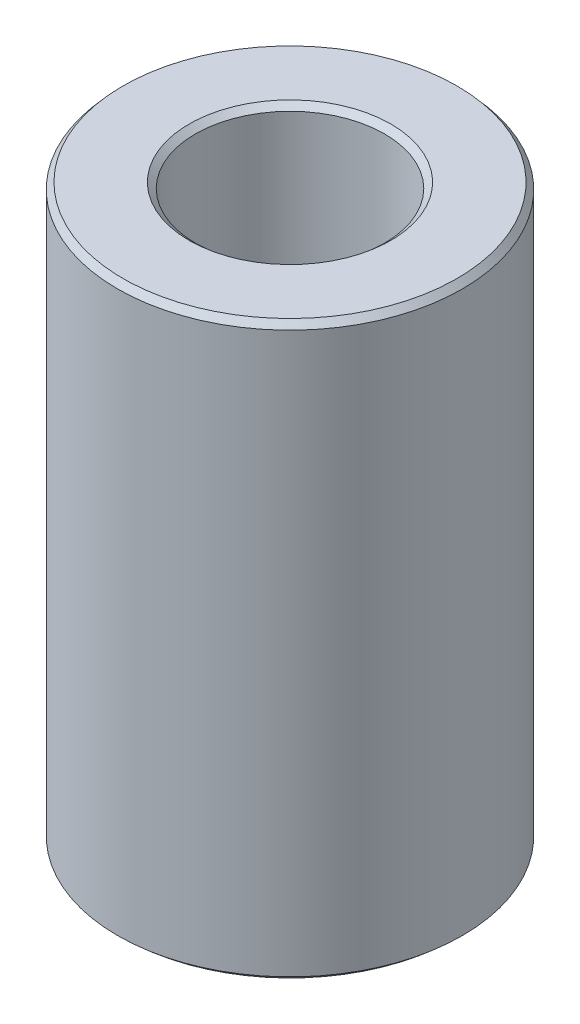
from build123d import *
from OCP.BRepFilletAPI import BRepFilletAPI_MakeChamfer

# Parameters (mm, degrees)
SKETCH1_R           = 12.5
BOSS_EXTRUDE1_DEPTH = 41.463838457
SKETCH2_R           = 6.860220899
CUT_EXTRUDE1_DEPTH  = 46.07493649
CHAMFER1_SIZE       = 0.454538693
CHAMFER1_SIZE2      = 0.394428066


with BuildPart() as part:
    # Sketch1 → Boss-Extrude1 (new body)
    with BuildSketch(Plane(origin=(0, 0, 0), x_dir=(1, 0, 0), z_dir=(0, 1, 0))):
        Circle(SKETCH1_R)
    extrude(amount=BOSS_EXTRUDE1_DEPTH)

    # Sketch2 → Cut-Extrude1 (cut, through all)
    with BuildSketch(Plane(origin=(0, 0, 0), x_dir=(1, 0, 0), z_dir=(0, 1, 0))):
        Circle(SKETCH2_R)
    extrude(amount=CUT_EXTRUDE1_DEPTH, mode=Mode.SUBTRACT)

    # Chamfer1: one chamfer whose edges measure the first distance from different faces: ONE call of the kernel's chamfer builder (chamfer() names one face for all edges)
    chamfer1_edges_1 = [part.edges().sort_by_distance(p)[0] for p in [
        (-6.860220899, 41.463838457, 0),
    ]]
    chamfer1_side_1 = [part.faces().sort_by_distance(p)[0] for p in [
        (-12.146446609, 41.463838457, 0),
    ]]
    chamfer1_edges_2 = [part.edges().sort_by_distance(p)[0] for p in [
        (-6.860220899, 0, 0),
    ]]
    chamfer1_side_2 = [part.faces().sort_by_distance(p)[0] for p in [
        (-6.860220899, 20.731919229, 0),
    ]]
    chamfer1_edges_3 = [part.edges().sort_by_distance(p)[0] for p in [
        (-12.5, 0, 0),
    ]]
    chamfer1_side_3 = [part.faces().sort_by_distance(p)[0] for p in [
        (-12.146446609, 0, 0),
    ]]
    chamfer1_edges_4 = [part.edges().sort_by_distance(p)[0] for p in [
        (-12.5, 41.463838457, 0),
    ]]
    chamfer1_side_4 = [part.faces().sort_by_distance(p)[0] for p in [
        (-12.5, 20.731919229, 0),
    ]]
    chamfer1 = BRepFilletAPI_MakeChamfer(part.part.solid().wrapped)
    for e in chamfer1_edges_1:
        chamfer1.Add(CHAMFER1_SIZE, CHAMFER1_SIZE2, e.wrapped, chamfer1_side_1[0].wrapped)  # the first distance lies on this face
    for e in chamfer1_edges_2:
        chamfer1.Add(CHAMFER1_SIZE, CHAMFER1_SIZE2, e.wrapped, chamfer1_side_2[0].wrapped)  # the first distance lies on this face
    for e in chamfer1_edges_3:
        chamfer1.Add(CHAMFER1_SIZE, CHAMFER1_SIZE2, e.wrapped, chamfer1_side_3[0].wrapped)  # the first distance lies on this face
    for e in chamfer1_edges_4:
        chamfer1.Add(CHAMFER1_SIZE, CHAMFER1_SIZE2, e.wrapped, chamfer1_side_4[0].wrapped)  # the first distance lies on this face
    add(Compound.cast(chamfer1.Shape()), mode=Mode.REPLACE)


solid = part.part
